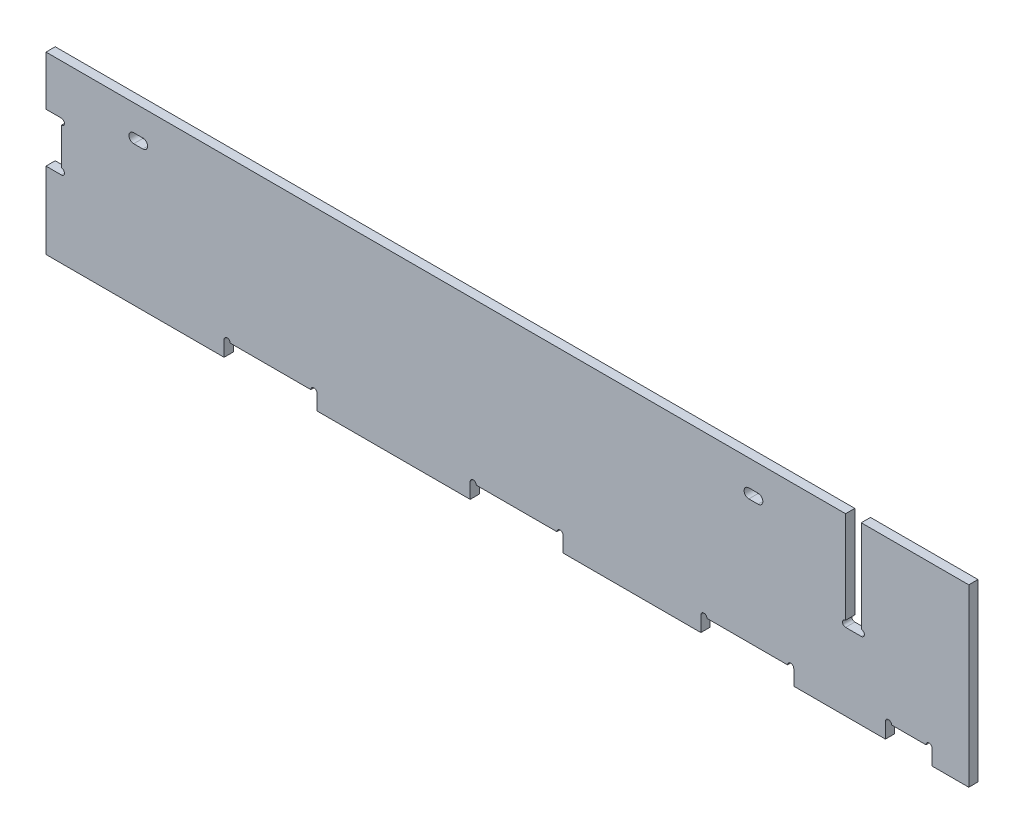
from build123d import *

# Parameters (mm, degrees)
SKETCH_1_W          = 300
SKETCH_1_H          = 57
EXTRUDE_1_DEPTH     = 3
SKETCH_2_W          = 5
SKETCH_2_H          = 16
SKETCH_2_W_2        = 30.2
SKETCH_2_H_2        = 5
SKETCH_2_W_3        = 15.2
SKETCH_2_W_4        = 5.1
SKETCH_2_H_3        = 32
CUT_EXTRUDE_1_DEPTH = 5
SKETCH_3_R          = 1
CUT_EXTRUDE_2_DEPTH = 5
CUT_EXTRUDE_6_DEPTH = 10


with BuildPart() as part:
    # 스케치1 → 보스-돌출1 (new body)
    with BuildSketch(Plane.XY):
        with Locations((150, 28.5)):
            Rectangle(SKETCH_1_W, SKETCH_1_H)
    extrude(amount=EXTRUDE_1_DEPTH)

    # 스케치2 → 컷-돌출1 (cut)
    with BuildSketch(Plane.XY.offset(3)):
        with Locations((2.5, 32.9)):
            Rectangle(SKETCH_2_W, SKETCH_2_H)
        with Locations((73, 2.5)):
            Rectangle(SKETCH_2_W_2, SKETCH_2_H_2)
        with Locations((153, 2.5)):
            Rectangle(SKETCH_2_W_2, SKETCH_2_H_2)
        with Locations((228, 2.5)):
            Rectangle(SKETCH_2_W_2, SKETCH_2_H_2)
        with Locations((280.5, 2.5)):
            Rectangle(SKETCH_2_W_3, SKETCH_2_H_2)
        with Locations((262.5, 41)):
            Rectangle(SKETCH_2_W_4, SKETCH_2_H_3)
    extrude(amount=-CUT_EXTRUDE_1_DEPTH, mode=Mode.SUBTRACT)

    # 스케치3 → 컷-돌출2 (cut)
    with BuildSketch(Plane.XY.offset(3)):
        with Locations((273.9, 5)):
            Circle(SKETCH_3_R)
        with Locations((287.1, 5)):
            Circle(SKETCH_3_R)
        with Locations((259.95, 26)):
            Circle(SKETCH_3_R)
        with Locations((265.05, 26)):
            Circle(SKETCH_3_R)
        with Locations((213.9, 5)):
            Circle(SKETCH_3_R)
        with Locations((242.1, 5)):
            Circle(SKETCH_3_R)
        with Locations((87.1, 5)):
            Circle(SKETCH_3_R)
        with Locations((138.9, 5)):
            Circle(SKETCH_3_R)
        with Locations((167.1, 5)):
            Circle(SKETCH_3_R)
        with Locations((5, 25.9)):
            Circle(SKETCH_3_R)
        with Locations((5, 39.9)):
            Circle(SKETCH_3_R)
        with Locations((58.9, 5)):
            Circle(SKETCH_3_R)
    extrude(amount=-CUT_EXTRUDE_2_DEPTH, mode=Mode.SUBTRACT)

    # 스케치8 → 컷-돌출6 (cut)
    with BuildSketch(Plane.XY.offset(3)):
        with BuildLine():
            Line((28.5, 48.55), (31.5, 48.55))
            ThreePointArc((31.5, 48.55), (33.05, 47), (31.5, 45.45))
            Line((31.5, 45.45), (28.5, 45.45))
            ThreePointArc((28.5, 45.45), (26.95, 47), (28.5, 48.55))
        make_face()
        with BuildLine():
            Line((228.5, 48.55), (231.5, 48.55))
            ThreePointArc((231.5, 48.55), (233.05, 47), (231.5, 45.45))
            Line((231.5, 45.45), (228.5, 45.45))
            ThreePointArc((228.5, 45.45), (226.95, 47), (228.5, 48.55))
        make_face()
    extrude(amount=-CUT_EXTRUDE_6_DEPTH, mode=Mode.SUBTRACT)


solid = part.part
